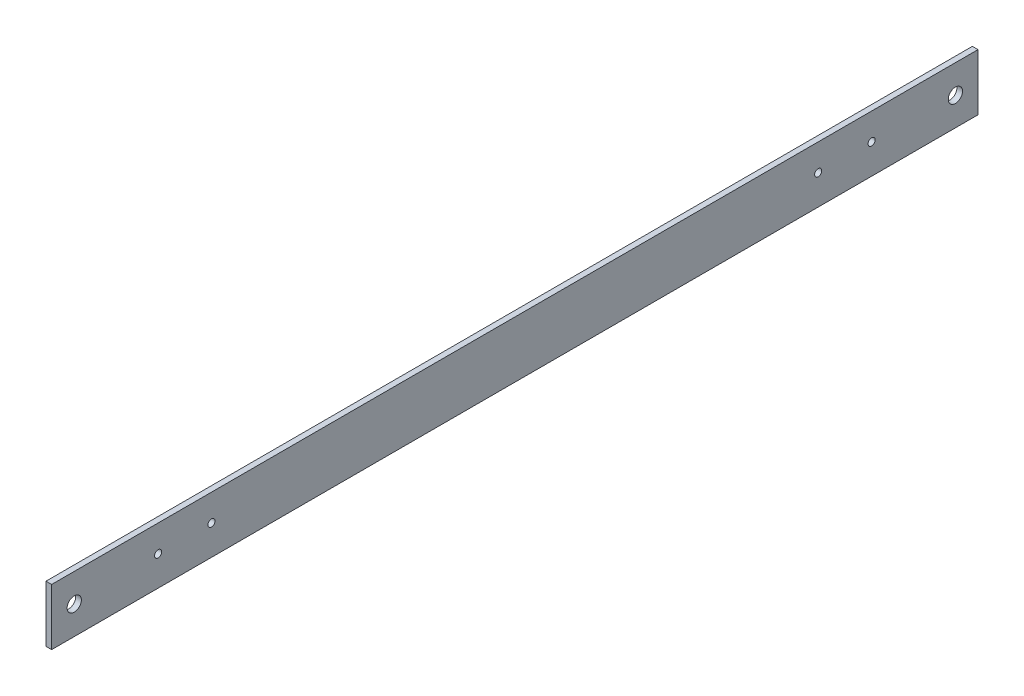
from build123d import *

# Parameters (mm, degrees)
SKETCH1_W           = 520.7
SKETCH1_H           = 31.75
SKETCH1_R           = 4
SKETCH1_R_2         = 2
BOSS_EXTRUDE2_DEPTH = 3.175


with BuildPart() as part:
    # Sketch1 → Boss-Extrude2 (new body)
    with BuildSketch(Plane(origin=(0, 0, 0), x_dir=(0, 0, -1), z_dir=(1, 0, 0))):
        with Locations((260.35, 15.875)):
            Rectangle(SKETCH1_W, SKETCH1_H)
        with Locations((12.7, 15.875)):
            Circle(SKETCH1_R, mode=Mode.SUBTRACT)
        with Locations((508, 15.875)):
            Circle(SKETCH1_R, mode=Mode.SUBTRACT)
        with Locations((59.825, 16.75)):
            Circle(SKETCH1_R_2, mode=Mode.SUBTRACT)
        with Locations((89.825, 16.75)):
            Circle(SKETCH1_R_2, mode=Mode.SUBTRACT)
        with Locations((430.875, 16.75)):
            Circle(SKETCH1_R_2, mode=Mode.SUBTRACT)
        with Locations((460.875, 16.75)):
            Circle(SKETCH1_R_2, mode=Mode.SUBTRACT)
    extrude(amount=BOSS_EXTRUDE2_DEPTH)


solid = part.part
